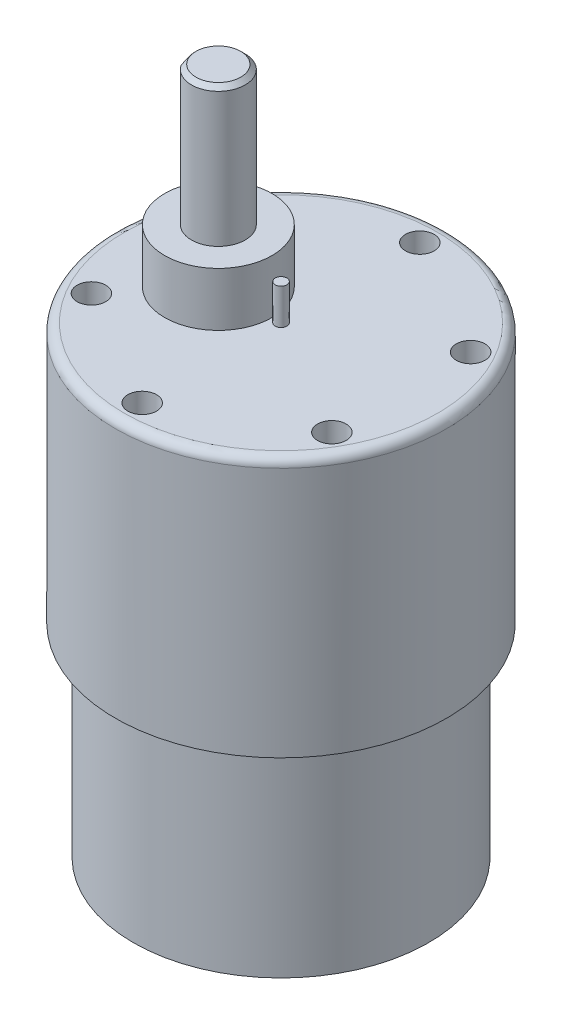
from build123d import *

# Parameters (mm, degrees)
SKETCH_1_R          = 7.5
EXTRUDE_1_DEPTH     = 5
SKETCH_2_R          = 16.5
EXTRUDE_2_DEPTH     = 22.7
SKETCH_3_R          = 18.5
EXTRUDE_3_DEPTH     = 29
SKETCH_4_R          = 1.6
CUT_EXTRUDE_1_DEPTH = 10
SKETCH_5_R          = 6
EXTRUDE_4_DEPTH     = 6
SKETCH_6_R          = 3
EXTRUDE_5_DEPTH     = 15.5
CUT_EXTRUDE_START   = -12
CUT_EXTRUDE_2_DEPTH = 12
CHAMFER_1_SIZE      = 0.5
FILLET_1_R          = 1
FILLET_2_R          = 1
FILLET_3_R          = 1
SKETCH_8_R          = 0.654296706
EXTRUDE_6_DEPTH     = 4


with BuildPart() as part:
    # Эскиз1 → Бобышка-Вытянуть1 (new body)
    with BuildSketch(Plane(origin=(0, 0, 0), x_dir=(1, 0, 0), z_dir=(0, 1, 0))):
        with Locations(Location((0, 0, 0), (0, 0, 270))):
            Circle(SKETCH_1_R)
    extrude(amount=EXTRUDE_1_DEPTH)

    # Эскиз2 → Бобышка-Вытянуть2 (add)
    with BuildSketch(Plane(origin=(0, 5, 0), x_dir=(1, 0, 0), z_dir=(0, 1, 0))):
        with Locations(Location((0, 0, 0), (0, 0, 270))):
            Circle(SKETCH_2_R)
    extrude(amount=EXTRUDE_2_DEPTH)

    # Эскиз3 → Бобышка-Вытянуть3 (add)
    with BuildSketch(Plane(origin=(0, 27.7, 0), x_dir=(1, 0, 0), z_dir=(0, 1, 0))):
        with Locations(Location((0, 0, 0), (0, 0, 90))):
            Circle(SKETCH_3_R)
    extrude(amount=EXTRUDE_3_DEPTH)

    # Эскиз4 → Вырез-Вытянуть1 (cut)
    with BuildSketch(Plane(origin=(0, 56.7, 0), x_dir=(1, 0, 0), z_dir=(0, 1, 0))):
        with Locations(Location((0, -15.5, 0), (0, 0, 270))):
            Circle(SKETCH_4_R)
        with Locations(Location((-13.423393759, -7.75, 0), (0, 0, 270))):
            Circle(SKETCH_4_R)
        with Locations(Location((-13.423393759, 7.75, 0), (0, 0, 270))):
            Circle(SKETCH_4_R)
        with Locations(Location((0, 15.5, 0), (0, 0, 270))):
            Circle(SKETCH_4_R)
        with Locations(Location((13.423393759, 7.75, 0), (0, 0, 270))):
            Circle(SKETCH_4_R)
        with Locations(Location((13.423393759, -7.75, 0), (0, 0, 270))):
            Circle(SKETCH_4_R)
    extrude(amount=-CUT_EXTRUDE_1_DEPTH, mode=Mode.SUBTRACT)

    # Эскиз5 → Бобышка-Вытянуть4 (add)
    with BuildSketch(Plane(origin=(0, 56.7, 0), x_dir=(1, 0, 0), z_dir=(0, 1, 0))):
        with Locations(Location((-7, 0, 0), (0, 0, 270))):
            Circle(SKETCH_5_R)
    extrude(amount=EXTRUDE_4_DEPTH)

    # Эскиз6 → Бобышка-Вытянуть5 (add)
    with BuildSketch(Plane(origin=(0, 62.7, 0), x_dir=(1, 0, 0), z_dir=(0, 1, 0))):
        with Locations(Location((-7, 0, 0), (0, 0, 270))):
            Circle(SKETCH_6_R)
    extrude(amount=EXTRUDE_5_DEPTH)

    # Эскиз7 → Вырез-Вытянуть2 (cut)
    with BuildSketch(Plane(origin=(0, 78.2, 0), x_dir=(1, 0, 0), z_dir=(0, 1, 0)).offset(CUT_EXTRUDE_START)):
        with BuildLine():
            Line((-9.533328229, 1.606937486), (-9.465630062, -1.708996312))
            ThreePointArc((-9.465630062, -1.708996312), (-9.999374975, -0.061235296), (-9.533328229, 1.606937486))
        make_face()
    extrude(amount=CUT_EXTRUDE_2_DEPTH, mode=Mode.SUBTRACT)

    # Фаска1
    chamfer_1_edges = [part.edges().sort_by_distance(p)[0] for p in [
        (-4.371234847, 78.2, -1.445542725),
    ]]
    chamfer(chamfer_1_edges, length=CHAMFER_1_SIZE - 0.0001)  # a hair under: the kernel refuses the full size

    # Скругление1
    fillet_1_edges = [part.edges().sort_by_distance(p)[0] for p in [
        (0, 56.7, 18.5),
    ]]
    fillet(fillet_1_edges, radius=FILLET_1_R)

    # Скругление2
    fillet_2_edges = [part.edges().sort_by_distance(p)[0] for p in [
        (0, 27.7, -16.5),
    ]]
    fillet(fillet_2_edges, radius=FILLET_2_R)

    # Скругление3
    fillet_3_edges = [part.edges().sort_by_distance(p)[0] for p in [
        (0, 0, -7.5),
    ]]
    fillet(fillet_3_edges, radius=FILLET_3_R)

    # Эскиз8 → Бобышка-Вытянуть6 (add)
    with BuildSketch(Plane(origin=(0, 56.7, 0), x_dir=(1, 0, 0), z_dir=(0, 1, 0))):
        with Locations(Location((0, 0, 0), (0, 0, 270))):
            Circle(SKETCH_8_R)
    extrude(amount=EXTRUDE_6_DEPTH)


solid = part.part
